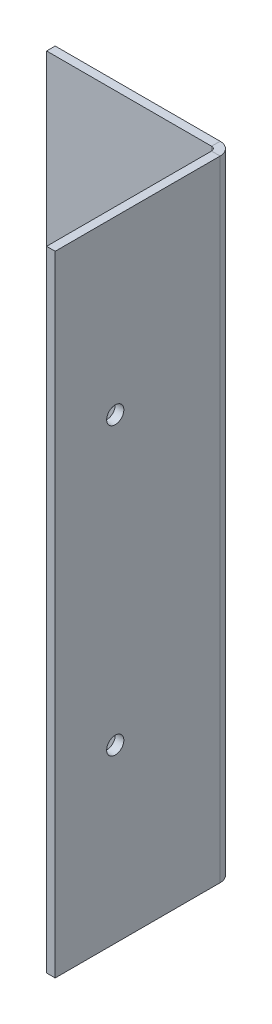
from build123d import *

# Parameters (mm, degrees)
SKETCH2_W              = 60
SKETCH2_H              = 110
BASE_FLANGE1_DEPTH     = 1.5
SKETCHED_BEND1_DEPTH   = 110
SKETCHED_BEND1_2_DEPTH = 110
F_3_0MM_DOWEL_HOLE2_D  = 3


# Read off the part's stored shape, not the designer's step: Sketched Bend1
# Sheet-metal steps are written as plain solids
with BuildPart() as part:
    # Sketch2 → Base-Flange1 (new body)
    with BuildSketch(Plane.XY):
        with Locations((30, 55)):
            Rectangle(SKETCH2_W, SKETCH2_H)
    extrude(amount=-BASE_FLANGE1_DEPTH)

    # Sketched Bend1 outline → Sketched Bend1 (cut)
    with BuildSketch(Plane(origin=(0, 0, 0), x_dir=(1, 0, 0), z_dir=(0, 1, 0))):
        with BuildLine():
            ThreePointArc((28.83242709, 1.5), (30.127591172, 1.086838938), (30.944250946, 0))
            Line((30.944250946, 0), (60, 0))
            Line((60, 0), (60, 1.5))
            Line((60, 1.5), (28.83242709, 1.5))
        make_face()
    extrude(amount=SKETCHED_BEND1_DEPTH, mode=Mode.SUBTRACT)

    # Sketched Bend1 2 outline → Sketched Bend1 2 (add)
    with BuildSketch(Plane(origin=(0, 0, 0), x_dir=(1, 0, 0), z_dir=(0, 1, 0))):
        with BuildLine():
            Line((29.56902709, -0.7366), (29.56902709, -29.56902709))
            Line((29.56902709, -29.56902709), (31.06902709, -29.56902709))
            Line((31.06902709, -29.56902709), (31.06902709, -0.7366))
            ThreePointArc((31.06902709, -0.7366), (31.037612433, -0.363053267), (30.944250946, 0))
            Line((30.944250946, 0), (28.83242709, 0))
            ThreePointArc((28.83242709, 0), (29.353281945, -0.215745145), (29.56902709, -0.7366))
        make_face()
    extrude(amount=SKETCHED_BEND1_2_DEPTH)

    # Ø3.0mm Dowel Hole2 (through all)
    with Locations(Plane(origin=(29.56902709, -1.119987894, 38.304969563), x_dir=(0, 0, 1), z_dir=(-1, 0, 0))):
        with Locations((-19.237938753, 81.119987894), (-19.237938753, 31.119987894)):
            Hole(F_3_0MM_DOWEL_HOLE2_D / 2)


solid = part.part
